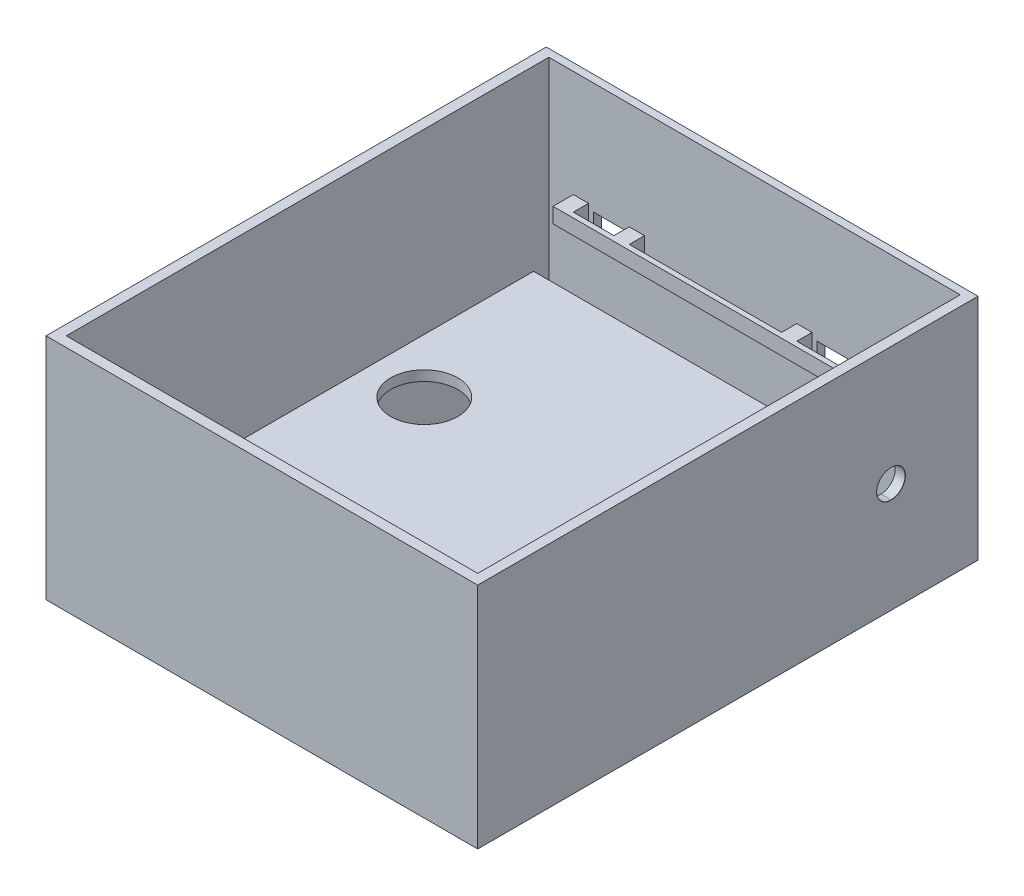
from build123d import *

# Parameters (mm, degrees)
SKETCH_1_W                     = 85
SKETCH_1_H                     = 98.49643328
EXTRUDE_1_DEPTH                = 2
SKETCH_1_6_W                   = 2
SKETCH_1_6_H                   = 95
EXTRUDE_2_DEPTH                = 45
SKETCH_1_7_W                   = 54
SKETCH_1_7_H                   = 2
BOSS_EXTRUDE1_DEPTH            = 1
SKETCH13_W                     = 6
SKETCH13_H                     = 6
CUT_EXTRUDE3_DEPTH             = 2
SKETCH15_W                     = 3
SKETCH15_H                     = 3
BOSS_EXTRUDE4_DEPTH            = 4
SKETCH16_W                     = 74
SKETCH16_H                     = 3
BOSS_EXTRUDE6_DEPTH            = 1
SKETCH17_W                     = 47
SKETCH17_H                     = 58
CUT_EXTRUDE4_DEPTH             = 2
BOSS_EXTRUDE7_DEPTH            = 18
SKETCH20_W                     = 2
SKETCH20_H                     = 60
BOSS_EXTRUDE8_DEPTH            = 38
SKETCH22_W                     = 49
SKETCH22_H                     = 60
SKETCH22_R                     = 6.609110004
BOSS_EXTRUDE10_DEPTH           = 2
SKETCH23_W                     = 51
SKETCH23_H                     = 2
BOSS_EXTRUDE11_DEPTH           = 4
SKETCH24_W                     = 12.403634637
SKETCH24_H                     = 7.948897958
CUT_EXTRUDE5_DEPTH             = 4
F_5_5_START                    = 31
F_5_5_5_5_DIAMETER_HOLE2_DEPTH = 4


with BuildPart() as part:
    # ｽｹｯﾁ1 → ﾎﾞｽ - 押し出し1 (new body)
    with BuildSketch(Plane(origin=(0, 0, 0), x_dir=(1, 0, 0), z_dir=(0, 1, 0))):
        with Locations((-8.696743418, 26.472097138)):
            Rectangle(SKETCH_1_W, SKETCH_1_H)
    extrude(amount=EXTRUDE_1_DEPTH)

    # ｽｹｯﾁ1<6> → ﾎﾞｽ - 押し出し2 (add)
    with BuildSketch(Plane(origin=(0, 0, 0), x_dir=(1, 0, 0), z_dir=(0, 1, 0))):
        with Locations((-50.196743418, 26.723880498)):
            Rectangle(SKETCH_1_6_W, SKETCH_1_6_H)
        Polygon((33.803256582, -20.776119502), (31.803256582, -20.776119502), (-22.196743418, -20.776119502), (-24.196743418, -20.776119502), (-49.196743418, -20.776119502), (-51.196743418, -20.776119502), (-51.196743418, -22.776119502), (33.803256582, -22.776119502), align=None)
        Polygon((-22.196743418, 74.223880498), (31.803256582, 74.223880498), (31.803256582, 75.720313778), (-51.196743418, 75.720313778), (-51.196743418, 74.223880498), (-49.196743418, 74.223880498), (-24.196743418, 74.223880498), align=None)
        Polygon((31.803256582, 50.223880498), (31.803256582, 48.223880498), (31.803256582, -20.776119502), (33.803256582, -20.776119502), (33.803256582, 75.720313778), (31.803256582, 75.720313778), (31.803256582, 74.223880498), align=None)
    extrude(amount=EXTRUDE_2_DEPTH)

    # ｽｹｯﾁ1<7> → Boss-Extrude1 (add)
    with BuildSketch(Plane(origin=(0, 0, 0), x_dir=(1, 0, 0), z_dir=(0, 1, 0))):
        with Locations((4.803256582, 49.223880498)):
            Rectangle(SKETCH_1_7_W, SKETCH_1_7_H)
        Polygon((-22.196743418, -20.776119502), (-22.196743418, 48.223880498), (-22.196743418, 50.223880498), (-22.196743418, 74.223880498), (-24.196743418, 74.223880498), (-24.196743418, -20.776119502), align=None)
    extrude(amount=BOSS_EXTRUDE1_DEPTH)

    # Sketch13 → Cut-Extrude3 (cut)
    with BuildSketch(Plane(origin=(0, 0, -75.720313778), x_dir=(-1, 0, 0), z_dir=(0, 0, -1))):
        with Locations((-6.631529016, 20)):
            Rectangle(SKETCH13_W, SKETCH13_H)
        with Locations((-22.631529016, 20)):
            Rectangle(SKETCH13_W, SKETCH13_H)
        with Locations((37.368470984, 20)):
            Rectangle(SKETCH13_W, SKETCH13_H)
    extrude(amount=-CUT_EXTRUDE3_DEPTH, mode=Mode.SUBTRACT)

    # Sketch15 → Boss-Extrude4 (add)
    with BuildSketch(Plane.XY.offset(-74.223880498)):
        with Locations((-42.868470984, 22.5)):
            Rectangle(SKETCH15_W, SKETCH15_H)
        with Locations((28.131529016, 22.5)):
            Rectangle(SKETCH15_W, SKETCH15_H)
        with Locations((-31.868470984, 22.5)):
            Rectangle(SKETCH15_W, SKETCH15_H)
        with Locations((1.131529016, 22.5)):
            Rectangle(SKETCH15_W, SKETCH15_H)
    extrude(amount=BOSS_EXTRUDE4_DEPTH)

    # Sketch16 → Boss-Extrude6 (add)
    with BuildSketch(Plane.XY.offset(-70.223880498)):
        with Locations((-7.368470984, 22.5)):
            Rectangle(SKETCH16_W, SKETCH16_H)
    extrude(amount=-BOSS_EXTRUDE6_DEPTH)

    # Sketch17 → Cut-Extrude4 (cut)
    with BuildSketch(Plane(origin=(0, 2, 0), x_dir=(1, 0, 0), z_dir=(0, 1, 0))):
        with Locations((8.303256582, 8.223880498)):
            Rectangle(SKETCH17_W, SKETCH17_H)
    extrude(amount=-CUT_EXTRUDE4_DEPTH, mode=Mode.SUBTRACT)

    # Sketch19 → Boss-Extrude7 (add)
    with BuildSketch(Plane.XZ):
        Polygon((31.803256582, -37.223880498), (-15.196743418, -37.223880498), (-15.196743418, 20.776119502), (-17.196743418, 20.776119502), (-17.196743418, -39.223880498), (31.803256582, -39.223880498), align=None)
    extrude(amount=-BOSS_EXTRUDE7_DEPTH)


with BuildPart() as body_2:
    # Sketch20 → Boss-Extrude8 (new body)
    with BuildSketch(Plane(origin=(0, 2, 0), x_dir=(1, 0, 0), z_dir=(0, 1, 0))):
        Polygon((-19.196743418, 39.223880498), (-17.196743418, 39.223880498), (31.803256582, 39.223880498), (31.803256582, 41.223880498), (-19.196743418, 41.223880498), align=None)
        with Locations((-18.196743418, 9.223880498)):
            Rectangle(SKETCH20_W, SKETCH20_H)
    extrude(amount=BOSS_EXTRUDE8_DEPTH)


with BuildPart() as body_3:
    # Sketch22 → Boss-Extrude10 (new body)
    with BuildSketch(Plane(origin=(0, 40, 0), x_dir=(1, 0, 0), z_dir=(0, 1, 0))):
        with Locations((7.303256582, 9.223880498)):
            Rectangle(SKETCH22_W, SKETCH22_H)
        with Locations(Location((-8.5, 9, 0), (0, 0, 270))):
            Circle(SKETCH22_R, mode=Mode.SUBTRACT)
    extrude(amount=-BOSS_EXTRUDE10_DEPTH)

    # Combine1: union body 2
    add(body_2.part)


with BuildPart() as body_3_2:
    # Sketch23 → Boss-Extrude11 (new body)
    with BuildSketch(Plane(origin=(0, 2, 0), x_dir=(1, 0, 0), z_dir=(0, 1, 0))):
        with Locations((6.303256582, 42.223880498)):
            Rectangle(SKETCH23_W, SKETCH23_H)
        Polygon((-21.196743418, -20.776119502), (-19.196743418, -20.776119502), (-19.196743418, 41.223880498), (-19.196743418, 43.223880498), (-21.196743418, 43.223880498), align=None)
    extrude(amount=BOSS_EXTRUDE11_DEPTH)

    # Combine2: union part
    add(part.part)


with BuildPart() as cut_extrude5_tool:
    # Sketch24 → Cut-Extrude5 (new body)
    with BuildSketch(Plane(origin=(0, 0, -41.223880498), x_dir=(-1, 0, 0), z_dir=(0, 0, -1))):
        with Locations((-6.201817319, 20.818151846)):
            Rectangle(SKETCH24_W, SKETCH24_H)
    extrude(amount=-CUT_EXTRUDE5_DEPTH)


with BuildPart() as body_3_1:
    add(body_3.part)

    # Cut-Extrude5: cut by cut_extrude5_tool
    add(cut_extrude5_tool.part, mode=Mode.SUBTRACT)


with BuildPart() as body_3_2_1:
    add(body_3_2.part)

    # Cut-Extrude5: cut by cut_extrude5_tool
    add(cut_extrude5_tool.part, mode=Mode.SUBTRACT)

    # Ø5.5 (5.5) Diameter Hole2: read off the stored shape, not the designer's step
    # Ø5.5 (5.5) Diameter Hole2 outline → Ø5.5 (5.5) Diameter Hole2 (cut)
    with BuildSketch(Plane.YZ.offset(F_5_5_START)):
        with BuildLine():
            Line((24.325677948, -58.642288451), (24.325677948, -58.542288451))
            ThreePointArc((24.325677948, -58.542288451), (21.575677948, -55.792288451), (18.825677948, -58.542288451))
            Line((18.825677948, -58.542288451), (18.825677948, -58.642288451))
            ThreePointArc((18.825677948, -58.642288451), (21.575677948, -61.392288451), (24.325677948, -58.642288451))
        make_face()
    extrude(amount=F_5_5_5_5_DIAMETER_HOLE2_DEPTH, mode=Mode.SUBTRACT)

    # 5.5 _5.5_ Diameter Hole2 2: loft between two sections, ruled curve by curve
    f_5_5_5_5_diameter_hole2_2_from = [
        Edge.make_three_point_arc((33.778256582, 24.325677948, -58.542288451), (33.778256582, 23.520221596, -56.597744802), (33.778256582, 21.575677948, -55.792288451)),
        Edge.make_three_point_arc((33.778256582, 21.575677948, -55.792288451), (33.778256582, 19.6311343, -56.597744802), (33.778256582, 18.825677948, -58.542288451)),
        Edge.make_three_point_arc((33.778256582, 18.825677948, -58.642288451), (33.778256582, 19.6311343, -60.586832099), (33.778256582, 21.575677948, -61.392288451)),
        Edge.make_three_point_arc((33.778256582, 21.575677948, -61.392288451), (33.778256582, 23.520221596, -60.586832099), (33.778256582, 24.325677948, -58.642288451)),
        Edge.make_line((33.778256582, 18.825677948, -58.542288451), (33.778256582, 18.825677948, -58.642288451)),
        Edge.make_line((33.778256582, 24.325677948, -58.542288451), (33.778256582, 24.325677948, -58.642288451)),
    ]
    f_5_5_5_5_diameter_hole2_2_to = [
        Edge.make_three_point_arc((33.803256582, 24.350677948, -58.542288451), (33.803256582, 23.537899266, -56.580067133), (33.803256582, 21.575677948, -55.767288451)),
        Edge.make_three_point_arc((33.803256582, 21.575677948, -55.767288451), (33.803256582, 19.61345663, -56.580067133), (33.803256582, 18.800677948, -58.542288451)),
        Edge.make_three_point_arc((33.803256582, 18.800677948, -58.642288451), (33.803256582, 19.61345663, -60.604509769), (33.803256582, 21.575677948, -61.417288451)),
        Edge.make_three_point_arc((33.803256582, 21.575677948, -61.417288451), (33.803256582, 23.537899266, -60.604509769), (33.803256582, 24.350677948, -58.642288451)),
        Edge.make_line((33.803256582, 18.800677948, -58.542288451), (33.803256582, 18.800677948, -58.642288451)),
        Edge.make_line((33.803256582, 24.350677948, -58.542288451), (33.803256582, 24.350677948, -58.642288451)),
    ]
    f_5_5_5_5_diameter_hole2_2 = Solid(Shell([*[Face.make_surface_from_curves(f_5_5_5_5_diameter_hole2_2_from[k], f_5_5_5_5_diameter_hole2_2_to[k]) for k in range(6)], Face(Wire(f_5_5_5_5_diameter_hole2_2_from)), Face(Wire(f_5_5_5_5_diameter_hole2_2_to))]))
    add(f_5_5_5_5_diameter_hole2_2, mode=Mode.SUBTRACT)


solid = Compound([body_3_1.part, body_3_2_1.part])
